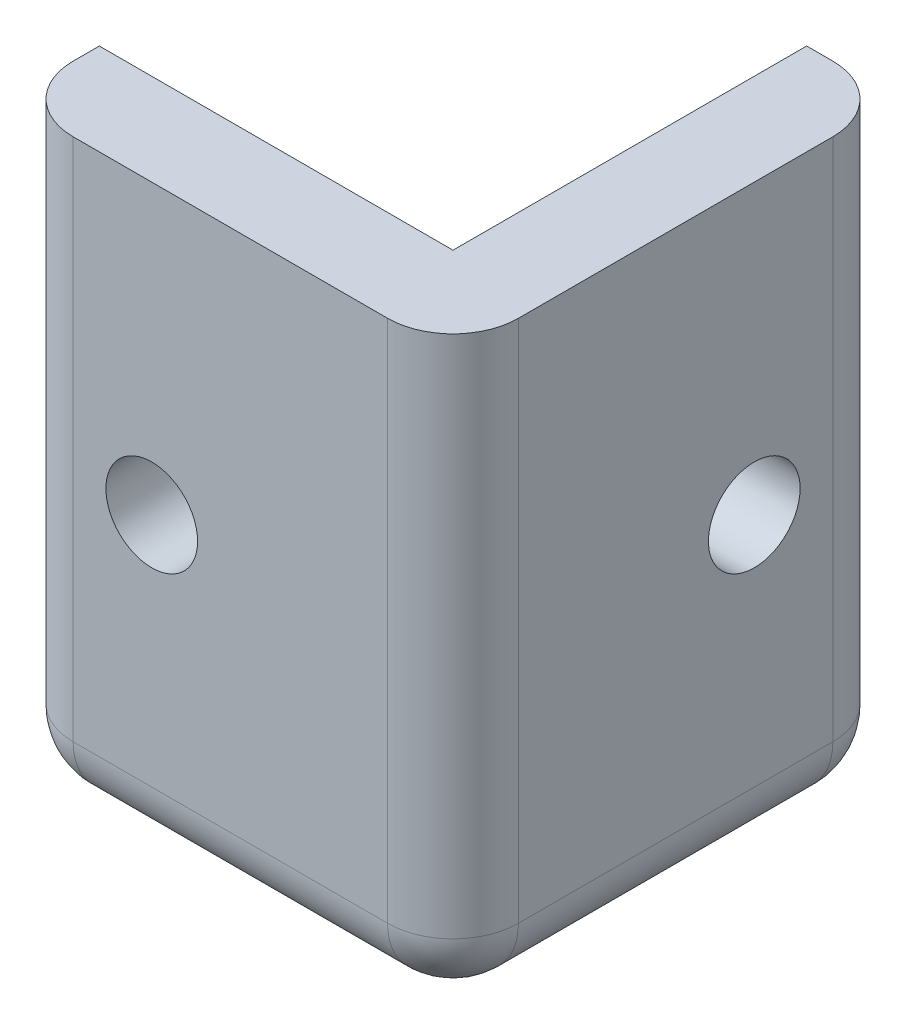
from build123d import *

# Parameters (mm, degrees)
SALIENTE_EXTRUIR1_DEPTH = 28
CROQUIS2_W              = 34
CROQUIS2_H              = 34
SALIENTE_EXTRUIR2_DEPTH = 7
REDONDEO1_R             = 5
CROQUIS3_R              = 3.5
CORTAR_EXTRUIR1_DEPTH   = 5
CROQUIS4_R              = 2
CORTAR_EXTRUIR2_DEPTH   = 5
CROQUIS5_R              = 3.5
CORTAR_EXTRUIR3_DEPTH   = 5
CROQUIS6_R              = 2
CORTAR_EXTRUIR4_DEPTH   = 5
REDONDEO2_R             = 5
SALIENTE_EXTRUIR3_START = 10
SALIENTE_EXTRUIR3_DEPTH = 10


with BuildPart() as part:
    # Croquis1 → Saliente-Extruir1 (new body)
    with BuildSketch(Plane(origin=(0, 0, 0), x_dir=(1, 0, 0), z_dir=(0, 1, 0))):
        Polygon((0, 0), (27, 0), (27, 27), (34, 27), (34, -7), (0, -7), align=None)
    extrude(amount=SALIENTE_EXTRUIR1_DEPTH)

    # Croquis2 → Saliente-Extruir2 (add)
    with BuildSketch(Plane(origin=(0, 0, 0), x_dir=(-1, 0, 0), z_dir=(0, -1, 0))):
        with Locations((-17, 10)):
            Rectangle(CROQUIS2_W, CROQUIS2_H)
    extrude(amount=SALIENTE_EXTRUIR2_DEPTH)

    # Redondeo1
    redondeo1_edges = [part.edges().sort_by_distance(p)[0] for p in [
        (34, 10.5, -27),
        (34, 10.5, 7),
        (0, 10.5, 7),
        (34, -7, -10),
        (17, -7, 7),
    ]]
    fillet(redondeo1_edges, radius=REDONDEO1_R)

    # Croquis3 → Cortar-Extruir1 (cut)
    with BuildSketch(Plane(origin=(34, 0, 0), x_dir=(0, 0, -1), z_dir=(1, 0, 0))):
        with Locations((16, 16)):
            Circle(CROQUIS3_R)
    extrude(amount=-CORTAR_EXTRUIR1_DEPTH, mode=Mode.SUBTRACT)

    # Croquis4 → Cortar-Extruir2 (cut)
    with BuildSketch(Plane(origin=(29, 0, 0), x_dir=(0, 0, -1), z_dir=(1, 0, 0))):
        with Locations((16, 16)):
            Circle(CROQUIS4_R)
    extrude(amount=-CORTAR_EXTRUIR2_DEPTH, mode=Mode.SUBTRACT)

    # Croquis5 → Cortar-Extruir3 (cut)
    with BuildSketch(Plane.XY.offset(7)):
        with Locations((11, 16)):
            Circle(CROQUIS5_R)
    extrude(amount=-CORTAR_EXTRUIR3_DEPTH, mode=Mode.SUBTRACT)

    # Croquis6 → Cortar-Extruir4 (cut)
    with BuildSketch(Plane.XY.offset(2)):
        with Locations((11, 16)):
            Circle(CROQUIS6_R)
    extrude(amount=-CORTAR_EXTRUIR4_DEPTH, mode=Mode.SUBTRACT)

    # Redondeo2
    # the kernel refuses this fillet: 5 mm, written as the material it takes off along each edge
    with BuildSketch(Plane(origin=(29, -2, -22), x_dir=(0, -1, 0), z_dir=(0, 0, -1))) as redondeo2_piece_1_section:
        Polygon((0, 0), (REDONDEO2_R, 0), (REDONDEO2_R, -REDONDEO2_R), (0, -REDONDEO2_R), align=None)
    redondeo2_piece_1 = extrude(amount=REDONDEO2_R, mode=Mode.PRIVATE)
    redondeo2_piece_1 = redondeo2_piece_1 - Plane(origin=(29, -2, -22), x_dir=(-0.7071067811865475, 0.7071067811865475, 0), z_dir=(0, 0, -1)) * Sphere(REDONDEO2_R, mode=Mode.PRIVATE)
    add(redondeo2_piece_1, mode=Mode.SUBTRACT)
    with BuildSketch(Plane(origin=(5, -2, 2), x_dir=(0, -1, 0), z_dir=(-1, 0, 0))) as redondeo2_piece_2_section:
        Polygon((0, 0), (REDONDEO2_R, 0), (REDONDEO2_R, REDONDEO2_R), (0, REDONDEO2_R), align=None)
    redondeo2_piece_2 = extrude(amount=REDONDEO2_R, mode=Mode.PRIVATE)
    redondeo2_piece_2 = redondeo2_piece_2 - Plane(origin=(5, -2, 2), x_dir=(0, 0.7071067811865475, -0.7071067811865475), z_dir=(-1, 0, 0)) * Sphere(REDONDEO2_R, mode=Mode.PRIVATE)
    add(redondeo2_piece_2, mode=Mode.SUBTRACT)
    with BuildSketch(Plane(origin=(-12.5, -7, -27), x_dir=(0, 1, 0), z_dir=(1, 0, 0)), Plane(origin=(0, -7, 2), x_dir=(0, 1, 0), z_dir=(0, 0, -1))) as redondeo2_piece_3:
        with BuildLine():
            CenterArc((REDONDEO2_R, REDONDEO2_R), REDONDEO2_R, 180, 90)
            Line((0, REDONDEO2_R), (0, 0))
            Line((0, 0), (REDONDEO2_R, 0))
        make_face()
    extrude(amount=41.5, mode=Mode.SUBTRACT)

    # Croquis7 → Saliente-Extruir3 (add)
    with BuildSketch(Plane(origin=(0, 28, 0), x_dir=(1, 0, 0), z_dir=(0, 1, 0)).offset(SALIENTE_EXTRUIR3_START)):
        with BuildLine():
            Line((34, -2), (34, 22))
            ThreePointArc((34, 22), (32.535533906, 25.535533906), (29, 27))
            Line((29, 27), (27, 27))
            Line((27, 27), (27, 0))
            Line((27, 0), (0, 0))
            Line((0, 0), (0, -2))
            ThreePointArc((0, -2), (1.464466094, -5.535533906), (5, -7))
            Line((5, -7), (29, -7))
            ThreePointArc((29, -7), (32.535533906, -5.535533906), (34, -2))
        make_face()
    extrude(amount=-SALIENTE_EXTRUIR3_DEPTH)


solid = part.part
